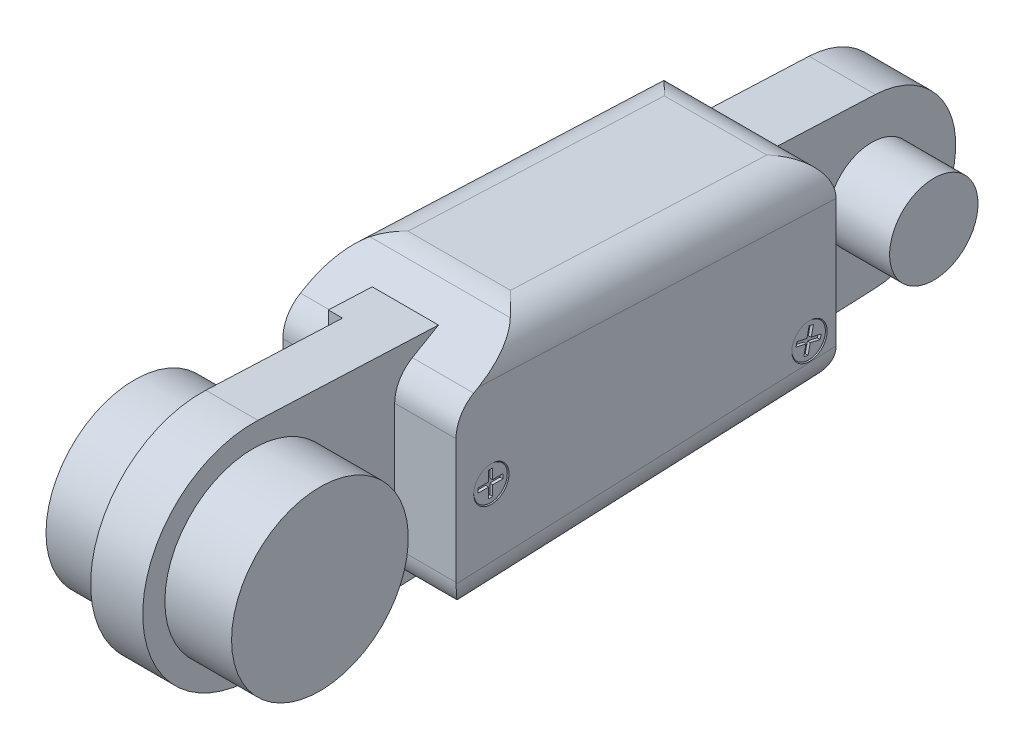
from build123d import *

# Parameters (mm, degrees)
BOSS_EXTRUDE1_DEPTH              = 2.95
BOSS_EXTRUDE2_DEPTH              = 1.6
SKETCH3_R                        = 10
BOSS_EXTRUDE3_DEPTH              = 10.5
FILLET1_R                        = 4
BOSS_EXTRUDE4_DEPTH              = 5.15
BOSS_EXTRUDE4_DEPTH_BACK         = 14.45
CUT_EXTRUDE1_REACH               = 87.429
CUT_EXTRUDE1_OFFSET_FROM_SURFACE = 1.5
SKETCH6_W                        = 0.00999999999999979
SKETCH6_H                        = 45.002265551352366
SKETCH6_W_2                      = 0.01000000000000023
SKETCH6_H_2                      = 45.03954427852518
FILLET2_R                        = 4
BOSS_EXTRUDE5_DEPTH              = 7.02
BOSS_EXTRUDE5_DEPTH_BACK         = 10.6
SKETCH7_R                        = 5.000000000000004
SKETCH8_R                        = 2.000000000000003
CUT_EXTRUDE2_DEPTH               = 0.1
CUT_EXTRUDE2_DRAFT               = -45.0000000000001
CUT_EXTRUDE2_PROFILE_2_DEPTH     = 0.1
CUT_EXTRUDE2_PROFILE_2_DRAFT     = -45.0000000000001
CUT_EXTRUDE3_DEPTH               = 0.3
CUT_EXTRUDE3_DRAFT               = -5.000000000000011
CUT_EXTRUDE3_PROFILE_2_DEPTH     = 0.3
CUT_EXTRUDE3_PROFILE_2_DRAFT     = -5.000000000000011


with BuildPart() as part:
    # Sketch1 → Boss-Extrude1 (new, symmetric)
    with BuildSketch(Plane(origin=(0, 0, 0), x_dir=(0, 0, -1), z_dir=(1, 0, 0))):
        with BuildLine():
            Line((0.5357142857142857, -12.488515132075614), (70.40714285714286, -9.491271500377467))
            ThreePointArc((70.40714285714286, -9.491271500377467), (79.5, 0), (70.40714285714286, 9.491271500377463))
            Line((70.40714285714286, 9.491271500377463), (0.5357142857142858, 12.488515132075614))
            ThreePointArc((0.5357142857142858, 12.488515132075614), (-12.499999999999998, 1.53e-15), (0.5357142857142857, -12.488515132075614))
        make_face()
    extrude(amount=BOSS_EXTRUDE1_DEPTH, both=True)

    # Sketch2 → Boss-Extrude2 (add)
    with BuildSketch(Plane.ZY.offset(2.95)):
        with BuildLine():
            Line((-70.40714285714286, 9.491271500377463), (-16, 11.825150537654586))
            Line((-16, 11.825150537654586), (-15.999999999999993, -11.825150537654586))
            Line((-15.999999999999993, -11.825150537654586), (-70.40714285714286, -9.491271500377465))
            ThreePointArc((-70.40714285714286, -9.491271500377465), (-79.5, 1.16e-15), (-70.40714285714286, 9.491271500377463))
        make_face()
    extrude(amount=BOSS_EXTRUDE2_DEPTH)

    # Sketch3 → Boss-Extrude3 (add, symmetric)
    with BuildSketch(Plane(origin=(0, 0, 0), x_dir=(0, 0, -1), z_dir=(1, 0, 0))):
        with Locations(Location((0, 0, 0), (0, 0, 180))):
            Circle(SKETCH3_R)
    extrude(amount=BOSS_EXTRUDE3_DEPTH, both=True)

    # Fillet1
    fillet1_edges = [part.edges().sort_by_distance(p)[0] for p in [
        (-3.75, -11.825150537654586, -15.999999999999993),
    ]]
    fillet(fillet1_edges, radius=FILLET1_R)

    # Sketch4 → Boss-Extrude4 (add, two sides: drawn at the far end of the back side and taken through both)
    with BuildSketch(Plane.ZY.offset(4.55).offset(-BOSS_EXTRUDE4_DEPTH_BACK)):
        Polygon((-15.999999999999993, -11.825150537654581), (-15.999999999999993, 8.745228199074802), (-24.999999999999993, 13.941380621781402), (-58.99999999999999, 12.482897725964271), (-58.99999999999999, -9.980598640003508), align=None)
    extrude(amount=BOSS_EXTRUDE4_DEPTH + BOSS_EXTRUDE4_DEPTH_BACK)

    # Cut-Extrude1: up to this face of the body (flat: up to its plane, moved by the offset)
    cut_extrude1_end = Plane(part.part.faces().sort_by_distance((-0.231891902, 12.029817895, -11.228816075))[0]).offset(-CUT_EXTRUDE1_OFFSET_FROM_SURFACE)
    # Sketch6 → Cut-Extrude1 (cut, up to the picked face)
    with BuildSketch(Plane(origin=(0, -12.488515132075618, -0.5357142857142859), x_dir=(1, 0, 0), z_dir=(0, -0.9990812105660494, -0.04285714285714288)), mode=Mode.PRIVATE) as cut_extrude1_sk1:
        with Locations((-4.555, -37.97963997883348)):
            Rectangle(SKETCH6_W, SKETCH6_H)
    cut_extrude1_tool1 = split(extrude(cut_extrude1_sk1.sketch, amount=-CUT_EXTRUDE1_REACH, mode=Mode.PRIVATE), bisect_by=cut_extrude1_end, keep=Keep.BOTH, mode=Mode.PRIVATE)
    # Sketch6 → Cut-Extrude1 (cut, up to the picked face)
    with BuildSketch(Plane(origin=(0, -12.488515132075618, -0.5357142857142859), x_dir=(1, 0, 0), z_dir=(0, -0.9990812105660494, -0.04285714285714288)), mode=Mode.PRIVATE) as cut_extrude1_sk2:
        with Locations((2.955, -37.99827934241989)):
            Rectangle(SKETCH6_W_2, SKETCH6_H_2)
    cut_extrude1_tool2 = split(extrude(cut_extrude1_sk2.sketch, amount=-CUT_EXTRUDE1_REACH, mode=Mode.PRIVATE), bisect_by=cut_extrude1_end, keep=Keep.BOTH, mode=Mode.PRIVATE)
    add(cut_extrude1_tool1.solids().sort_by(Axis((-4.555, -10.860816, -38.480459), (0, 0.9990812105660494, 0.04285714285714288)))[0], mode=Mode.SUBTRACT)
    add(cut_extrude1_tool2.solids().sort_by(Axis((2.955, -10.860017, -38.499081), (0, 0.9990812105660494, 0.04285714285714288)))[0], mode=Mode.SUBTRACT)

    # Fillet2
    # the kernel refuses this fillet: 4 mm, written as the material it adds along each edge
    # the kernel refuses this fillet: 4 mm, written as the material it takes off along each edge
    with BuildSketch(Plane(origin=(-14.988161901436335, -11.825150537654586, -15.999999999999993), x_dir=(0, 0.04285714285714257, -0.9990812105660493), z_dir=(1, 0, 0))) as fillet2_2_piece_1:
        with BuildLine():
            CenterArc((FILLET2_R * 1.04381619014, FILLET2_R), FILLET2_R, 177.54371427641803, 92.45628572358197)
            Line((FILLET2_R * 0.0447349795776, FILLET2_R * 1.04285714286), (0, 0))
            Line((0, 0), (FILLET2_R * 1.04381619014, 0))
        make_face()
    extrude(amount=12.038161901436336, mode=Mode.SUBTRACT)
    with BuildSketch(Plane(origin=(-14.988161901436335, -11.825150537654586, -15.999999999999993), x_dir=(0, 0.04285714285714257, -0.9990812105660493), z_dir=(1, 0, 0))) as fillet2_2_piece_2_section:
        with BuildLine():
            CenterArc((FILLET2_R * 1.04381619014, FILLET2_R), FILLET2_R, 177.54371427641803, 92.45628572358197)
            Line((FILLET2_R * 0.0447349795776, FILLET2_R * 1.04285714286), (0, 0))
            Line((0, 0), (FILLET2_R * 1.04381619014, 0))
        make_face()
    fillet2_2_piece_2 = extrude(amount=22.47632380287267, mode=Mode.PRIVATE)
    fillet2_2_piece_2 = split(fillet2_2_piece_2, bisect_by=Plane(origin=(2.9600000000000004, -10.846311572952873, -16.937750318441594), z_dir=(1, 0, 0)), keep=Keep.TOP, mode=Mode.PRIVATE)
    add(fillet2_2_piece_2, mode=Mode.SUBTRACT)
    with BuildSketch(Plane(origin=(-7.478161901436335, -11.825150537654586, -15.999999999999993), x_dir=(0, 0.04285714285714257, -0.9990812105660493), z_dir=(1, 0, 0))) as fillet2_2_piece_3_section:
        with BuildLine():
            CenterArc((FILLET2_R * 1.04381619014, FILLET2_R), FILLET2_R, 177.54371427641803, 92.45628572358197)
            Line((FILLET2_R * 0.0447349795776, FILLET2_R * 1.04285714286), (0, 0))
            Line((0, 0), (FILLET2_R * 1.04381619014, 0))
        make_face()
    fillet2_2_piece_3 = extrude(amount=27.816323802872674, mode=Mode.PRIVATE)
    fillet2_2_piece_3 = split(fillet2_2_piece_3, bisect_by=Plane(origin=(-2.95, -10.846311572952875, -16.937750318441612), z_dir=(-1, 0, 0)), keep=Keep.TOP, mode=Mode.PRIVATE)
    add(fillet2_2_piece_3, mode=Mode.SUBTRACT)
    with BuildSketch(Plane(origin=(2.960000000000001, -11.825150537654581, -15.999999999999993), x_dir=(0, 0.042857142857141296, -0.9990812105660493), z_dir=(1, 0, 0))) as fillet2_2_piece_4:
        with BuildLine():
            CenterArc((FILLET2_R * 1.04381619014, FILLET2_R), FILLET2_R, 177.54371427641803, 92.45628572358203)
            Line((FILLET2_R * 0.0447349795776, FILLET2_R * 1.04285714286), (0, 0))
            Line((0, 0), (FILLET2_R * 1.04381619014, -1e-17))
        make_face()
    extrude(amount=17.378161901436336, mode=Mode.SUBTRACT)
    with BuildSketch(Plane(origin=(9.899999999999999, -9.552027211432081, -68.9908121056605), x_dir=(0, 0.9990812105660493, 0.04285714285714272), z_dir=(0, -0.042857142857142726, 0.9990812105660493))) as fillet2_2_piece_5:
        with BuildLine():
            CenterArc((FILLET2_R, FILLET2_R), FILLET2_R, 180, 90)
            Line((-6.1e-16, FILLET2_R), (0, 0))
            Line((0, 0), (FILLET2_R, 0))
        make_face()
    extrude(amount=63.039544278525156, mode=Mode.SUBTRACT)
    with BuildSketch(Plane(origin=(-6.620230786249788, -9.980598640003508, -58.99999999999999), x_dir=(0, -0.042857142857142885, 0.9990812105660493), z_dir=(1, 0, 0))) as fillet2_2_piece_6_section:
        with BuildLine():
            CenterArc((FILLET2_R * 0.958023078625, -FILLET2_R), FILLET2_R, 89.99999999999999, 87.54371427641804)
            Line((-FILLET2_R * 0.0410581319411, -FILLET2_R * 0.957142857143), (0, 0))
            Line((0, 0), (FILLET2_R * 0.958023078625, 0))
        make_face()
    fillet2_2_piece_6 = extrude(amount=26.100461572499576, mode=Mode.PRIVATE)
    fillet2_2_piece_6 = split(fillet2_2_piece_6, bisect_by=Plane(origin=(-4.55, -9.166381712824048, -58.15010718912109), z_dir=(-1, 0, 0)), keep=Keep.TOP, mode=Mode.PRIVATE)
    add(fillet2_2_piece_6, mode=Mode.SUBTRACT)
    with BuildSketch(Plane(origin=(2.960000000000001, -9.980598640003508, -58.99999999999999), x_dir=(0, -0.042857142857142885, 0.9990812105660493), z_dir=(1, 0, 0))) as fillet2_2_piece_7:
        with BuildLine():
            CenterArc((FILLET2_R * 0.958023078625, -FILLET2_R), FILLET2_R, 89.99999999999999, 87.54371427641804)
            Line((-FILLET2_R * 0.0410581319411, -FILLET2_R * 0.957142857143), (0, 0))
            Line((0, 0), (FILLET2_R * 0.958023078625, 0))
        make_face()
    extrude(amount=16.520230786249787, mode=Mode.SUBTRACT)
    with BuildSketch(Plane(origin=(-19.28023078624979, 12.482897725964271, -58.99999999999999), x_dir=(0, 0.042857142857142885, 0.9990812105660493), z_dir=(1, 0, 0))) as fillet2_2_piece_8_section:
        with BuildLine():
            CenterArc((FILLET2_R * 0.958023078625, FILLET2_R), FILLET2_R, 182.45628572358197, 87.54371427641803)
            Line((-FILLET2_R * 0.0410581319411, FILLET2_R * 0.957142857143), (0, 0))
            Line((0, 0), (FILLET2_R * 0.958023078625, 0))
        make_face()
    fillet2_2_piece_8 = extrude(amount=38.76046157249958, mode=Mode.PRIVATE)
    fillet2_2_piece_8 = split(fillet2_2_piece_8, bisect_by=Plane(origin=(-7.12500000000003, 10.021335989457187, -58.05033519049316), z_dir=(0, 0.9990812105660493, -0.042857142857142906)), keep=Keep.TOP, mode=Mode.PRIVATE)
    add(fillet2_2_piece_8, mode=Mode.SUBTRACT)
    with BuildSketch(Plane(origin=(-19.28023078624979, 12.482897725964271, -58.99999999999999), x_dir=(0, 0.042857142857142885, 0.9990812105660493), z_dir=(1, 0, 0))) as fillet2_2_piece_9_section:
        with BuildLine():
            CenterArc((FILLET2_R * 0.958023078625, FILLET2_R), FILLET2_R, 182.45628572358197, 87.54371427641803)
            Line((-FILLET2_R * 0.0410581319411, FILLET2_R * 0.957142857143), (0, 0))
            Line((0, 0), (FILLET2_R * 0.958023078625, 0))
        make_face()
    fillet2_2_piece_9 = extrude(amount=38.76046157249958, mode=Mode.PRIVATE)
    fillet2_2_piece_9 = split(fillet2_2_piece_9, bisect_by=Plane(origin=(-4.55, 9.653804076800146, -58.93114204733473), z_dir=(-1, 0, 0)), keep=Keep.TOP, mode=Mode.PRIVATE)
    add(fillet2_2_piece_9, mode=Mode.SUBTRACT)
    with BuildSketch(Plane(origin=(-19.28023078624979, 12.482897725964271, -58.99999999999999), x_dir=(0, 0.042857142857142885, 0.9990812105660493), z_dir=(1, 0, 0))) as fillet2_2_piece_10_section:
        with BuildLine():
            CenterArc((FILLET2_R * 0.958023078625, FILLET2_R), FILLET2_R, 182.45628572358197, 87.54371427641803)
            Line((-FILLET2_R * 0.0410581319411, FILLET2_R * 0.957142857143), (0, 0))
            Line((0, 0), (FILLET2_R * 0.958023078625, 0))
        make_face()
    fillet2_2_piece_10 = extrude(amount=38.76046157249958, mode=Mode.PRIVATE)
    fillet2_2_piece_10 = split(fillet2_2_piece_10, bisect_by=Plane(origin=(2.95, 9.653804076800148, -58.931142047334724), z_dir=(1, 0, 0)), keep=Keep.TOP, mode=Mode.PRIVATE)
    add(fillet2_2_piece_10, mode=Mode.SUBTRACT)
    with BuildSketch(Plane(origin=(9.899999999999999, 14.36995205035283, -15.009187894339503), x_dir=(-1, 0, 0), z_dir=(0, -0.04285714285714283, -0.9990812105660493))) as fillet2_2_piece_11:
        with BuildLine():
            CenterArc((FILLET2_R, -FILLET2_R), FILLET2_R, 90, 90)
            Line((0, -FILLET2_R), (0, 0))
            Line((0, 0), (FILLET2_R, 0))
        make_face()
    extrude(amount=54.03126756906639, mode=Mode.SUBTRACT)
    with BuildSketch(Plane(origin=(12.810595773347721, 13.941380621781402, -24.999999999999993), x_dir=(0, -0.4999999999999976, 0.8660254037844399), z_dir=(-1, 0, 0))) as fillet2_2_piece_12:
        with BuildLine():
            CenterArc((FILLET2_R * 0.291059577335, -FILLET2_R), FILLET2_R, 90.00000000000003, 32.45628572358184)
            Line((-FILLET2_R * 0.245596402396, -FILLET2_R * 0.156198862635), (0, 0))
            Line((0, 0), (FILLET2_R * 0.291059577335, 4e-17))
        make_face()
    extrude(amount=25.421191546695447, mode=Mode.SUBTRACT)
    with BuildSketch(Plane(origin=(15.673502691896278, 8.745228199074802, -15.999999999999993), x_dir=(0, 0.49999999999999767, -0.8660254037844399), z_dir=(-1, 0, 0))) as fillet2_2_piece_13:
        with BuildLine():
            CenterArc((FILLET2_R * 0.57735026919, FILLET2_R), FILLET2_R, 209.99999999999983, 60.00000000000023)
            Line((-FILLET2_R * 0.288675134595, FILLET2_R * 0.5), (0, 0))
            Line((0, 0), (FILLET2_R * 0.57735026919, 0))
        make_face()
    extrude(amount=12.713502691896277, mode=Mode.SUBTRACT)
    with BuildSketch(Plane(origin=(-9.7, -9.55202721143208, -68.99081210566048), x_dir=(1, -1.5e-16, -1e-17), z_dir=(0, -0.042857142857142726, 0.9990812105660493))) as fillet2_2_piece_14:
        with BuildLine():
            CenterArc((FILLET2_R, FILLET2_R), FILLET2_R, 180, 90)
            Line((-6.1e-16, FILLET2_R), (0, 0))
            Line((0, 0), (FILLET2_R, 0))
        make_face()
    extrude(amount=63.039544278525156, mode=Mode.SUBTRACT)
    with BuildSketch(Plane(origin=(-9.7, 14.36995205035283, -15.009187894339501), x_dir=(0, -0.9990812105660493, 0.04285714285714283), z_dir=(0, -0.04285714285714283, -0.9990812105660493))) as fillet2_2_piece_15:
        with BuildLine():
            CenterArc((FILLET2_R, -FILLET2_R), FILLET2_R, 90, 90)
            Line((-1.77e-15, -FILLET2_R), (0, 0))
            Line((0, 0), (FILLET2_R, 0))
        make_face()
    extrude(amount=54.031267569066415, mode=Mode.SUBTRACT)
    with BuildSketch(Plane(origin=(1.2135026918962772, 8.745228199074806, -15.999999999999998), x_dir=(0, 0.4999999999999975, -0.8660254037844403), z_dir=(-1, 0, 0))) as fillet2_2_piece_16_section:
        with BuildLine():
            CenterArc((FILLET2_R * 0.57735026919, FILLET2_R), FILLET2_R, 209.99999999999983, 60.00000000000017)
            Line((-FILLET2_R * 0.288675134595, FILLET2_R * 0.5), (0, 0))
            Line((0, 0), (FILLET2_R * 0.57735026919, 0))
        make_face()
    fillet2_2_piece_16 = extrude(amount=16.687005383792552, mode=Mode.PRIVATE)
    fillet2_2_piece_16 = split(fillet2_2_piece_16, bisect_by=Plane(origin=(-4.55, 8.502953144076557, -16.419632704663513), z_dir=(-1, 0, 0)), keep=Keep.TOP, mode=Mode.PRIVATE)
    add(fillet2_2_piece_16, mode=Mode.SUBTRACT)
    with BuildSketch(Plane(origin=(-19.28023078624979, -9.980598640003508, -58.99999999999999), x_dir=(0, -0.042857142857142885, 0.9990812105660493), z_dir=(1, 0, 0))) as fillet2_2_piece_17_section:
        with BuildLine():
            CenterArc((FILLET2_R * 0.958023078625, -FILLET2_R), FILLET2_R, 89.99999999999999, 87.54371427641804)
            Line((-FILLET2_R * 0.0410581319411, -FILLET2_R * 0.957142857143), (0, 0))
            Line((0, 0), (FILLET2_R * 0.958023078625, 0))
        make_face()
    fillet2_2_piece_17 = extrude(amount=24.30046157249958, mode=Mode.PRIVATE)
    fillet2_2_piece_17 = split(fillet2_2_piece_17, bisect_by=Plane(origin=(-4.55, -9.166381712824048, -58.150107189121094), z_dir=(-1, 0, 0)), keep=Keep.TOP, mode=Mode.PRIVATE)
    add(fillet2_2_piece_17, mode=Mode.SUBTRACT)
    with BuildSketch(Plane(origin=(-19.28023078624979, -9.980598640003508, -58.99999999999999), x_dir=(0, -0.042857142857142885, 0.9990812105660493), z_dir=(1, 0, 0))) as fillet2_2_piece_18_section:
        with BuildLine():
            CenterArc((FILLET2_R * 0.958023078625, -FILLET2_R), FILLET2_R, 89.99999999999999, 87.54371427641804)
            Line((-FILLET2_R * 0.0410581319411, -FILLET2_R * 0.957142857143), (0, 0))
            Line((0, 0), (FILLET2_R * 0.958023078625, 0))
        make_face()
    fillet2_2_piece_18 = extrude(amount=24.30046157249958, mode=Mode.PRIVATE)
    fillet2_2_piece_18 = split(fillet2_2_piece_18, bisect_by=Plane(origin=(2.9600000000000004, -9.16638171282405, -58.15010718912107), z_dir=(1, 0, 0)), keep=Keep.TOP, mode=Mode.PRIVATE)
    add(fillet2_2_piece_18, mode=Mode.SUBTRACT)
    with BuildSketch(Plane(origin=(-20.138161901436334, -11.825150537654586, -15.999999999999993), x_dir=(0, 1, 0), z_dir=(1, 0, 0))) as fillet2_2_piece_19_section:
        with BuildLine():
            CenterArc((FILLET2_R * 1.04381619014, -FILLET2_R), FILLET2_R, 89.99999999999999, 92.45628572358197)
            Line((FILLET2_R * 0.0447349795776, -FILLET2_R * 1.04285714286), (0, 0))
            Line((0, 0), (FILLET2_R * 1.04381619014, 0))
        make_face()
    fillet2_2_piece_19 = extrude(amount=26.01632380287267, mode=Mode.PRIVATE)
    fillet2_2_piece_19 = split(fillet2_2_piece_19, bisect_by=Plane(origin=(-2.95, -10.846311572952871, -16.93775031844161), z_dir=(-1, 0, 0)), keep=Keep.TOP, mode=Mode.PRIVATE)
    add(fillet2_2_piece_19, mode=Mode.SUBTRACT)
    with BuildSketch(Plane(origin=(-20.138161901436334, -11.825150537654586, -15.999999999999993), x_dir=(0, 1, 0), z_dir=(1, 0, 0))) as fillet2_2_piece_20_section:
        with BuildLine():
            CenterArc((FILLET2_R * 1.04381619014, -FILLET2_R), FILLET2_R, 89.99999999999999, 92.45628572358197)
            Line((FILLET2_R * 0.0447349795776, -FILLET2_R * 1.04285714286), (0, 0))
            Line((0, 0), (FILLET2_R * 1.04381619014, 0))
        make_face()
    fillet2_2_piece_20 = extrude(amount=26.01632380287267, mode=Mode.PRIVATE)
    fillet2_2_piece_20 = split(fillet2_2_piece_20, bisect_by=Plane(origin=(2.9600000000000004, -10.846311572952871, -16.937750318441594), z_dir=(1, 0, 0)), keep=Keep.TOP, mode=Mode.PRIVATE)
    add(fillet2_2_piece_20, mode=Mode.SUBTRACT)

    # Sketch7 → Boss-Extrude5 (add, two sides: drawn at the far end of the back side and taken through both)
    with BuildSketch(Plane(origin=(2.95, 0, 0), x_dir=(0, 0, -1), z_dir=(1, 0, 0)).offset(-BOSS_EXTRUDE5_DEPTH_BACK)):
        with Locations((70, 0)):
            Circle(SKETCH7_R)
    extrude(amount=BOSS_EXTRUDE5_DEPTH + BOSS_EXTRUDE5_DEPTH_BACK)


with BuildPart() as cut_extrude2_tool:
    # Sketch8 → Cut-Extrude2 (with draft: the straight prism first)
    with BuildSketch(Plane(origin=(9.899999999999999, 0, 0), x_dir=(0, 0, -1), z_dir=(1, 0, 0))):
        with Locations((19.99999999999999, 0)):
            Circle(SKETCH8_R)
    extrude(amount=-CUT_EXTRUDE2_DEPTH)
    # Cut-Extrude2: the draft: its side faces are tilted about the plane it starts from
    cut_extrude2_sides = [cut_extrude2_tool.faces().sort_by_distance(p)[0] for p in [
        (9.85, 0, -18),
    ]]
    draft(cut_extrude2_sides, Plane(origin=(9.899999999999999, 0, 0), x_dir=(0, 0, -1), z_dir=(1, 0, 0)), CUT_EXTRUDE2_DRAFT)


with BuildPart() as part_1:
    add(part.part)

    # Cut-Extrude2: cut by cut_extrude2_tool
    add(cut_extrude2_tool.part, mode=Mode.SUBTRACT)


with BuildPart() as cut_extrude2_profile_2_tool:
    # Sketch8 → Cut-Extrude2 profile 2 (with draft: the straight prism first)
    with BuildSketch(Plane(origin=(9.899999999999999, 0, 0), x_dir=(0, 0, -1), z_dir=(1, 0, 0))):
        with Locations((55.999999999999986, -4)):
            Circle(SKETCH8_R)
    extrude(amount=-CUT_EXTRUDE2_PROFILE_2_DEPTH)
    # Cut-Extrude2 profile 2: the draft: its side faces are tilted about the plane it starts from
    cut_extrude2_profile_2_sides = [cut_extrude2_profile_2_tool.faces().sort_by_distance(p)[0] for p in [
        (9.85, -4, -54),
    ]]
    draft(cut_extrude2_profile_2_sides, Plane(origin=(9.899999999999999, 0, 0), x_dir=(0, 0, -1), z_dir=(1, 0, 0)), CUT_EXTRUDE2_PROFILE_2_DRAFT)


with BuildPart() as part_2:
    add(part_1.part)

    # Cut-Extrude2 profile 2: cut by cut_extrude2_profile_2_tool
    add(cut_extrude2_profile_2_tool.part, mode=Mode.SUBTRACT)


with BuildPart() as cut_extrude3_tool:
    # Sketch9 → Cut-Extrude3 (with draft: the straight prism first)
    with BuildSketch(Plane(origin=(9.799999999999999, 0, 0), x_dir=(0, 0, -1), z_dir=(1, 0, 0))):
        Polygon((20.24999999999999, -0.2500000000000001), (21.399999999999988, -0.25000000000000006), (21.399999999999988, 0.24999999999999994), (20.24999999999999, 0.24999999999999994), (20.250000000000007, 1.399999999999995), (19.750000000000007, 1.400000000000002), (19.749999999999993, 0.25000000000000183), (18.599999999999994, 0.2500000000000099), (18.599999999999987, -0.24999999999999015), (19.74999999999999, -0.2500000000000002), (19.749999999999986, -1.3999999999999986), (20.249999999999982, -1.3999999999999986), align=None)
    extrude(amount=-CUT_EXTRUDE3_DEPTH)
    # Cut-Extrude3: the draft: its side faces are tilted about the plane it starts from
    cut_extrude3_sides = [cut_extrude3_tool.faces().sort_by_distance(p)[0] for p in [
        (9.65, -0.25, -20.825),
        (9.65, 0, -21.4),
        (9.65, 0.25, -20.825),
        (9.65, 0.825, -20.25),
        (9.65, 1.4, -20),
        (9.65, 0.825, -19.75),
        (9.65, 0.25, -19.175),
        (9.65, 0, -18.6),
        (9.65, -0.25, -19.175),
        (9.65, -0.825, -19.75),
        (9.65, -1.4, -20),
        (9.65, -0.825, -20.25),
    ]]
    draft(cut_extrude3_sides, Plane(origin=(9.799999999999999, 0, 0), x_dir=(0, 0, -1), z_dir=(1, 0, 0)), CUT_EXTRUDE3_DRAFT)


with BuildPart() as part_3:
    add(part_2.part)

    # Cut-Extrude3: cut by cut_extrude3_tool
    add(cut_extrude3_tool.part, mode=Mode.SUBTRACT)


with BuildPart() as cut_extrude3_profile_2_tool:
    # Sketch9 → Cut-Extrude3 profile 2 (with draft: the straight prism first)
    with BuildSketch(Plane(origin=(9.799999999999999, 0, 0), x_dir=(0, 0, -1), z_dir=(1, 0, 0))):
        Polygon((55.70121951219512, -4.189024390243886), (55.44878048780488, -5.310975609756081), (55.93658536585367, -5.420731707317056), (56.189024390243894, -4.298780487804862), (57.31097560975609, -4.551219512195095), (57.42073170731707, -4.063414634146313), (56.29878048780487, -3.8109756097560785), (56.551219512195104, -2.6890243902438806), (56.063414634146326, -2.5792682926829116), (55.81097560975609, -3.701219512195106), (54.6890243902439, -3.448780487804864), (54.579268292682926, -3.936585365853644), align=None)
    extrude(amount=-CUT_EXTRUDE3_PROFILE_2_DEPTH)
    # Cut-Extrude3 profile 2: the draft: its side faces are tilted about the plane it starts from
    cut_extrude3_profile_2_sides = [cut_extrude3_profile_2_tool.faces().sort_by_distance(p)[0] for p in [
        (9.65, -4.75, -55.575),
        (9.65, -5.365853659, -55.692682927),
        (9.65, -4.859756098, -56.062804878),
        (9.65, -4.425, -56.75),
        (9.65, -4.307317073, -57.365853659),
        (9.65, -3.937195122, -56.859756098),
        (9.65, -3.25, -56.425),
        (9.65, -2.634146341, -56.307317073),
        (9.65, -3.140243902, -55.937195122),
        (9.65, -3.575, -55.25),
        (9.65, -3.692682927, -54.634146341),
        (9.65, -4.062804878, -55.140243902),
    ]]
    draft(cut_extrude3_profile_2_sides, Plane(origin=(9.799999999999999, 0, 0), x_dir=(0, 0, -1), z_dir=(1, 0, 0)), CUT_EXTRUDE3_PROFILE_2_DRAFT)


with BuildPart() as part_4:
    add(part_3.part)

    # Cut-Extrude3 profile 2: cut by cut_extrude3_profile_2_tool
    add(cut_extrude3_profile_2_tool.part, mode=Mode.SUBTRACT)


solid = part_4.part
